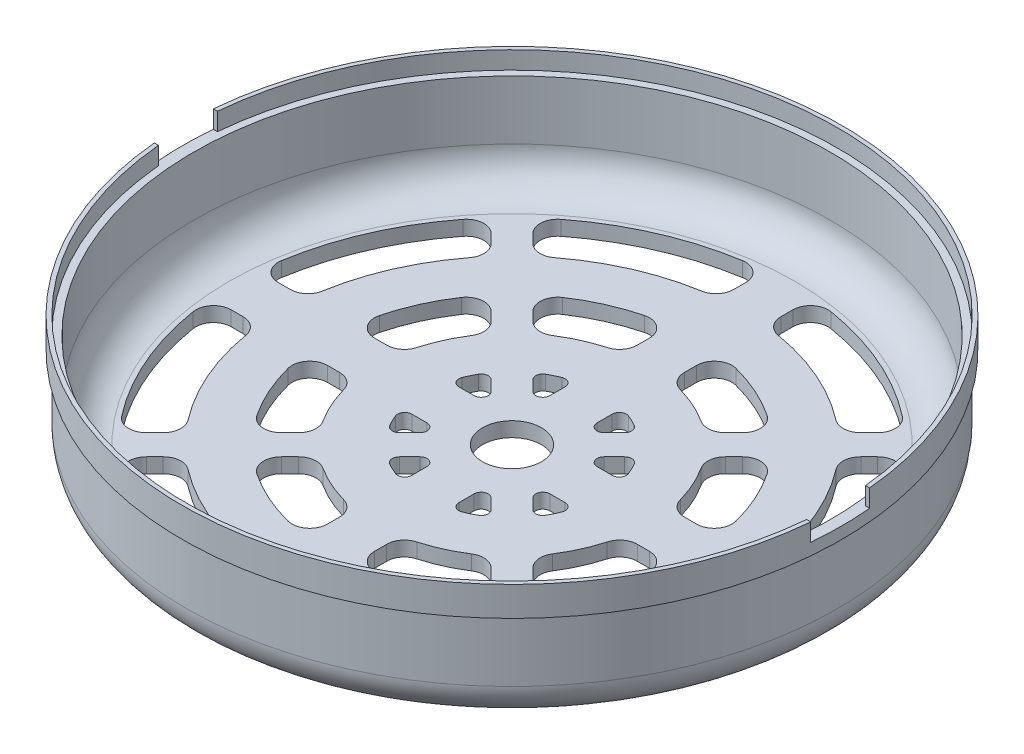
from build123d import *

# Parameters (mm, degrees)
SKETCH19_R          = 55.2
SKETCH19_R_2        = 5
BOSS_EXTRUDE1_DEPTH = 2.5
SKETCH20_R          = 55.2
SKETCH20_R_2        = 54
BOSS_EXTRUDE2_DEPTH = 16
FILLET1_R           = 6
SKETCH21_R          = 55.9
SKETCH21_R_2        = 55.2
BOSS_EXTRUDE3_DEPTH = 3
BOSS_EXTRUDE4_START = 2
SKETCH22_R          = 55.9
SKETCH22_R_2        = 54
BOSS_EXTRUDE4_DEPTH = 2
SKETCH23_W          = 205.777761972
SKETCH23_H          = 10
CUT_EXTRUDE1_DEPTH  = 4


with BuildPart() as part:
    # Sketch19 → Boss-Extrude1 (new body)
    with BuildSketch(Plane(origin=(0, 0, 0), x_dir=(1, 0, 0), z_dir=(0, 1, 0))):
        Circle(SKETCH19_R)
        Circle(SKETCH19_R_2, mode=Mode.SUBTRACT)
        with BuildLine():
            Line((11.315279718, 7.779745812), (9.584062043, 6.048528137))
            ThreePointArc((9.584062043, 6.048528137), (9.323934742, 4.740779881), (10.432590181, 4))
            Line((10.432590181, 4), (12.998461447, 4))
            ThreePointArc((12.998461447, 4), (13.992155853, 4.527265707), (14.112615286, 5.645714286))
            ThreePointArc((14.112615286, 5.645714286), (13.691809705, 6.601086805), (13.206419957, 7.525322047))
            ThreePointArc((13.206419957, 7.525322047), (12.323807885, 8.120503171), (11.315279718, 7.779745812))
        make_face(mode=Mode.SUBTRACT)
        with BuildLine():
            Line((7.779745812, 11.315279718), (6.048528137, 9.584062043))
            ThreePointArc((6.048528137, 9.584062043), (4.740779881, 9.323934742), (4, 10.432590181))
            Line((4, 10.432590181), (4, 12.998461447))
            ThreePointArc((4, 12.998461447), (4.527265707, 13.992155853), (5.645714286, 14.112615286))
            ThreePointArc((5.645714286, 14.112615286), (6.601086805, 13.691809705), (7.525322047, 13.206419957))
            ThreePointArc((7.525322047, 13.206419957), (8.120503171, 12.323807885), (7.779745812, 11.315279718))
        make_face(mode=Mode.SUBTRACT)
        with BuildLine():
            Line((-29.243440698, 32.778974604), (-27.817617952, 31.353151858))
            ThreePointArc((-27.817617952, 31.353151858), (-25.892213455, 30.480876207), (-23.869546594, 31.094770387))
            ThreePointArc((-23.869546594, 31.094770387), (-15.64959857, 35.940646413), (-6.502369668, 38.656942309))
            ThreePointArc((-6.502369668, 38.656942309), (-4.70948794, 39.677972547), (-4, 41.615381772))
            Line((-4, 41.615381772), (-4, 43.64218143))
            ThreePointArc((-4, 43.64218143), (-5.053893549, 45.925308602), (-7.475113122, 46.604320441))
            ThreePointArc((-7.475113122, 46.604320441), (-18.807456623, 43.291102728), (-28.962988252, 37.269093248))
            ThreePointArc((-28.962988252, 37.269093248), (-30.116285559, 35.087310264), (-29.243440698, 32.778974604))
        make_face(mode=Mode.SUBTRACT)
        with BuildLine():
            Line((-32.778974604, 29.243440698), (-31.353151858, 27.817617952))
            ThreePointArc((-31.353151858, 27.817617952), (-30.480876207, 25.892213455), (-31.094770387, 23.869546594))
            ThreePointArc((-31.094770387, 23.869546594), (-35.940646413, 15.64959857), (-38.656942309, 6.502369668))
            ThreePointArc((-38.656942309, 6.502369668), (-39.677972547, 4.70948794), (-41.615381772, 4))
            Line((-41.615381772, 4), (-43.64218143, 4))
            ThreePointArc((-43.64218143, 4), (-45.925308602, 5.053893549), (-46.604320441, 7.475113122))
            ThreePointArc((-46.604320441, 7.475113122), (-43.291102728, 18.807456623), (-37.269093248, 28.962988252))
            ThreePointArc((-37.269093248, 28.962988252), (-35.087310264, 30.116285559), (-32.778974604, 29.243440698))
        make_face(mode=Mode.SUBTRACT)
        with BuildLine():
            Line((-21.325246341, 17.789712435), (-19.881159788, 16.345625882))
            ThreePointArc((-19.881159788, 16.345625882), (-19.019238605, 14.540959916), (-19.483112178, 12.595568263))
            ThreePointArc((-19.483112178, 12.595568263), (-21.162980028, 9.506223033), (-22.356630537, 6.198473282))
            ThreePointArc((-22.356630537, 6.198473282), (-23.431614361, 4.612053167), (-25.247574141, 4))
            Line((-25.247574141, 4), (-27.317393726, 4))
            ThreePointArc((-27.317393726, 4), (-29.687419312, 5.160712441), (-30.223499442, 7.744680851))
            ThreePointArc((-30.223499442, 7.744680851), (-28.48866724, 12.72147157), (-25.940882289, 17.335242314))
            ThreePointArc((-25.940882289, 17.335242314), (-23.740534606, 18.653954494), (-21.325246341, 17.789712435))
        make_face(mode=Mode.SUBTRACT)
        with BuildLine():
            Line((-17.789712435, 21.325246341), (-16.345625882, 19.881159788))
            ThreePointArc((-16.345625882, 19.881159788), (-14.540959916, 19.019238605), (-12.595568263, 19.483112178))
            ThreePointArc((-12.595568263, 19.483112178), (-9.506223033, 21.162980028), (-6.198473282, 22.356630537))
            ThreePointArc((-6.198473282, 22.356630537), (-4.612053167, 23.431614361), (-4, 25.247574141))
            Line((-4, 25.247574141), (-4, 27.317393726))
            ThreePointArc((-4, 27.317393726), (-5.160712441, 29.687419312), (-7.744680851, 30.223499442))
            ThreePointArc((-7.744680851, 30.223499442), (-12.72147157, 28.48866724), (-17.335242314, 25.940882289))
            ThreePointArc((-17.335242314, 25.940882289), (-18.653954494, 23.740534606), (-17.789712435, 21.325246341))
        make_face(mode=Mode.SUBTRACT)
        with BuildLine():
            Line((-7.779745812, 11.315279718), (-6.048528137, 9.584062043))
            ThreePointArc((-6.048528137, 9.584062043), (-4.740779881, 9.323934742), (-4, 10.432590181))
            Line((-4, 10.432590181), (-4, 12.998461447))
            ThreePointArc((-4, 12.998461447), (-4.527265707, 13.992155853), (-5.645714286, 14.112615286))
            ThreePointArc((-5.645714286, 14.112615286), (-6.601086805, 13.691809705), (-7.525322047, 13.206419957))
            ThreePointArc((-7.525322047, 13.206419957), (-8.120503171, 12.323807885), (-7.779745812, 11.315279718))
        make_face(mode=Mode.SUBTRACT)
        with BuildLine():
            Line((-11.315279718, 7.779745812), (-9.584062043, 6.048528137))
            ThreePointArc((-9.584062043, 6.048528137), (-9.323934742, 4.740779881), (-10.432590181, 4))
            Line((-10.432590181, 4), (-12.998461447, 4))
            ThreePointArc((-12.998461447, 4), (-13.992155853, 4.527265707), (-14.112615286, 5.645714286))
            ThreePointArc((-14.112615286, 5.645714286), (-13.691809705, 6.601086805), (-13.206419957, 7.525322047))
            ThreePointArc((-13.206419957, 7.525322047), (-12.323807885, 8.120503171), (-11.315279718, 7.779745812))
        make_face(mode=Mode.SUBTRACT)
        with BuildLine():
            Line((4, 27.317393726), (4, 25.247574141))
            ThreePointArc((4, 25.247574141), (4.612053167, 23.431614361), (6.198473282, 22.356630537))
            ThreePointArc((6.198473282, 22.356630537), (9.506223033, 21.162980028), (12.595568263, 19.483112178))
            ThreePointArc((12.595568263, 19.483112178), (14.540959916, 19.019238605), (16.345625882, 19.881159788))
            Line((16.345625882, 19.881159788), (17.789712435, 21.325246341))
            ThreePointArc((17.789712435, 21.325246341), (18.653954494, 23.740534606), (17.335242314, 25.940882289))
            ThreePointArc((17.335242314, 25.940882289), (12.72147157, 28.48866724), (7.744680851, 30.223499442))
            ThreePointArc((7.744680851, 30.223499442), (5.160712441, 29.687419312), (4, 27.317393726))
        make_face(mode=Mode.SUBTRACT)
        with BuildLine():
            Line((21.325246341, 17.789712435), (19.881159788, 16.345625882))
            ThreePointArc((19.881159788, 16.345625882), (19.019238605, 14.540959916), (19.483112178, 12.595568263))
            ThreePointArc((19.483112178, 12.595568263), (21.162980028, 9.506223033), (22.356630537, 6.198473282))
            ThreePointArc((22.356630537, 6.198473282), (23.431614361, 4.612053167), (25.247574141, 4))
            Line((25.247574141, 4), (27.317393726, 4))
            ThreePointArc((27.317393726, 4), (29.687419312, 5.160712441), (30.223499442, 7.744680851))
            ThreePointArc((30.223499442, 7.744680851), (28.48866724, 12.72147157), (25.940882289, 17.335242314))
            ThreePointArc((25.940882289, 17.335242314), (23.740534606, 18.653954494), (21.325246341, 17.789712435))
        make_face(mode=Mode.SUBTRACT)
        with BuildLine():
            Line((32.778974604, 29.243440698), (31.353151858, 27.817617952))
            ThreePointArc((31.353151858, 27.817617952), (30.480876207, 25.892213455), (31.094770387, 23.869546594))
            ThreePointArc((31.094770387, 23.869546594), (35.940646413, 15.64959857), (38.656942309, 6.502369668))
            ThreePointArc((38.656942309, 6.502369668), (39.677972547, 4.70948794), (41.615381772, 4))
            Line((41.615381772, 4), (43.64218143, 4))
            ThreePointArc((43.64218143, 4), (45.925308602, 5.053893549), (46.604320441, 7.475113122))
            ThreePointArc((46.604320441, 7.475113122), (43.291102728, 18.807456623), (37.269093248, 28.962988252))
            ThreePointArc((37.269093248, 28.962988252), (35.087310264, 30.116285559), (32.778974604, 29.243440698))
        make_face(mode=Mode.SUBTRACT)
        with BuildLine():
            Line((4, 43.64218143), (4, 41.615381772))
            ThreePointArc((4, 41.615381772), (4.70948794, 39.677972547), (6.502369668, 38.656942309))
            ThreePointArc((6.502369668, 38.656942309), (15.64959857, 35.940646413), (23.869546594, 31.094770387))
            ThreePointArc((23.869546594, 31.094770387), (25.892213455, 30.480876207), (27.817617952, 31.353151858))
            Line((27.817617952, 31.353151858), (29.243440698, 32.778974604))
            ThreePointArc((29.243440698, 32.778974604), (30.116285559, 35.087310264), (28.962988252, 37.269093248))
            ThreePointArc((28.962988252, 37.269093248), (18.807456623, 43.291102728), (7.475113122, 46.604320441))
            ThreePointArc((7.475113122, 46.604320441), (5.053893549, 45.925308602), (4, 43.64218143))
        make_face(mode=Mode.SUBTRACT)
        with BuildLine():
            Line((4, -43.64218143), (4, -41.615381772))
            ThreePointArc((4, -41.615381772), (4.70948794, -39.677972547), (6.502369668, -38.656942309))
            ThreePointArc((6.502369668, -38.656942309), (15.64959857, -35.940646413), (23.869546594, -31.094770387))
            ThreePointArc((23.869546594, -31.094770387), (25.892213455, -30.480876207), (27.817617952, -31.353151858))
            Line((27.817617952, -31.353151858), (29.243440698, -32.778974604))
            ThreePointArc((29.243440698, -32.778974604), (30.116285559, -35.087310264), (28.962988252, -37.269093248))
            ThreePointArc((28.962988252, -37.269093248), (18.807456623, -43.291102728), (7.475113122, -46.604320441))
            ThreePointArc((7.475113122, -46.604320441), (5.053893549, -45.925308602), (4, -43.64218143))
        make_face(mode=Mode.SUBTRACT)
        with BuildLine():
            Line((32.778974604, -29.243440698), (31.353151858, -27.817617952))
            ThreePointArc((31.353151858, -27.817617952), (30.480876207, -25.892213455), (31.094770387, -23.869546594))
            ThreePointArc((31.094770387, -23.869546594), (35.940646413, -15.64959857), (38.656942309, -6.502369668))
            ThreePointArc((38.656942309, -6.502369668), (39.677972547, -4.70948794), (41.615381772, -4))
            Line((41.615381772, -4), (43.64218143, -4))
            ThreePointArc((43.64218143, -4), (45.925308602, -5.053893549), (46.604320441, -7.475113122))
            ThreePointArc((46.604320441, -7.475113122), (43.291102728, -18.807456623), (37.269093248, -28.962988252))
            ThreePointArc((37.269093248, -28.962988252), (35.087310264, -30.116285559), (32.778974604, -29.243440698))
        make_face(mode=Mode.SUBTRACT)
        with BuildLine():
            Line((27.317393726, -4), (25.247574141, -4))
            ThreePointArc((25.247574141, -4), (23.431614361, -4.612053167), (22.356630537, -6.198473282))
            ThreePointArc((22.356630537, -6.198473282), (21.162980028, -9.506223033), (19.483112178, -12.595568263))
            ThreePointArc((19.483112178, -12.595568263), (19.019238605, -14.540959916), (19.881159788, -16.345625882))
            Line((19.881159788, -16.345625882), (21.325246341, -17.789712435))
            ThreePointArc((21.325246341, -17.789712435), (23.740534606, -18.653954494), (25.940882289, -17.335242314))
            ThreePointArc((25.940882289, -17.335242314), (28.48866724, -12.72147157), (30.223499442, -7.744680851))
            ThreePointArc((30.223499442, -7.744680851), (29.687419312, -5.160712441), (27.317393726, -4))
        make_face(mode=Mode.SUBTRACT)
        with BuildLine():
            Line((12.998461447, -4), (10.432590181, -4))
            ThreePointArc((10.432590181, -4), (9.323934742, -4.740779881), (9.584062043, -6.048528137))
            Line((9.584062043, -6.048528137), (11.315279718, -7.779745812))
            ThreePointArc((11.315279718, -7.779745812), (12.323807885, -8.120503171), (13.206419957, -7.525322047))
            ThreePointArc((13.206419957, -7.525322047), (13.691809705, -6.601086805), (14.112615286, -5.645714286))
            ThreePointArc((14.112615286, -5.645714286), (13.992155853, -4.527265707), (12.998461447, -4))
        make_face(mode=Mode.SUBTRACT)
        with BuildLine():
            Line((4, -12.998461447), (4, -10.432590181))
            ThreePointArc((4, -10.432590181), (4.740779881, -9.323934742), (6.048528137, -9.584062043))
            Line((6.048528137, -9.584062043), (7.779745812, -11.315279718))
            ThreePointArc((7.779745812, -11.315279718), (8.120503171, -12.323807885), (7.525322047, -13.206419957))
            ThreePointArc((7.525322047, -13.206419957), (6.601086805, -13.691809705), (5.645714286, -14.112615286))
            ThreePointArc((5.645714286, -14.112615286), (4.527265707, -13.992155853), (4, -12.998461447))
        make_face(mode=Mode.SUBTRACT)
        with BuildLine():
            Line((4, -27.317393726), (4, -25.247574141))
            ThreePointArc((4, -25.247574141), (4.612053167, -23.431614361), (6.198473282, -22.356630537))
            ThreePointArc((6.198473282, -22.356630537), (9.506223033, -21.162980028), (12.595568263, -19.483112178))
            ThreePointArc((12.595568263, -19.483112178), (14.540959916, -19.019238605), (16.345625882, -19.881159788))
            Line((16.345625882, -19.881159788), (17.789712435, -21.325246341))
            ThreePointArc((17.789712435, -21.325246341), (18.653954494, -23.740534606), (17.335242314, -25.940882289))
            ThreePointArc((17.335242314, -25.940882289), (12.72147157, -28.48866724), (7.744680851, -30.223499442))
            ThreePointArc((7.744680851, -30.223499442), (5.160712441, -29.687419312), (4, -27.317393726))
        make_face(mode=Mode.SUBTRACT)
        with BuildLine():
            Line((-11.315279718, -7.779745812), (-9.584062043, -6.048528137))
            ThreePointArc((-9.584062043, -6.048528137), (-9.323934742, -4.740779881), (-10.432590181, -4))
            Line((-10.432590181, -4), (-12.998461447, -4))
            ThreePointArc((-12.998461447, -4), (-13.992155853, -4.527265707), (-14.112615286, -5.645714286))
            ThreePointArc((-14.112615286, -5.645714286), (-13.691809705, -6.601086805), (-13.206419957, -7.525322047))
            ThreePointArc((-13.206419957, -7.525322047), (-12.323807885, -8.120503171), (-11.315279718, -7.779745812))
        make_face(mode=Mode.SUBTRACT)
        with BuildLine():
            Line((-7.779745812, -11.315279718), (-6.048528137, -9.584062043))
            ThreePointArc((-6.048528137, -9.584062043), (-4.740779881, -9.323934742), (-4, -10.432590181))
            Line((-4, -10.432590181), (-4, -12.998461447))
            ThreePointArc((-4, -12.998461447), (-4.527265707, -13.992155853), (-5.645714286, -14.112615286))
            ThreePointArc((-5.645714286, -14.112615286), (-6.601086805, -13.691809705), (-7.525322047, -13.206419957))
            ThreePointArc((-7.525322047, -13.206419957), (-8.120503171, -12.323807885), (-7.779745812, -11.315279718))
        make_face(mode=Mode.SUBTRACT)
        with BuildLine():
            Line((-4, -27.317393726), (-4, -25.247574141))
            ThreePointArc((-4, -25.247574141), (-4.612053167, -23.431614361), (-6.198473282, -22.356630537))
            ThreePointArc((-6.198473282, -22.356630537), (-9.506223033, -21.162980028), (-12.595568263, -19.483112178))
            ThreePointArc((-12.595568263, -19.483112178), (-14.540959916, -19.019238605), (-16.345625882, -19.881159788))
            Line((-16.345625882, -19.881159788), (-17.789712435, -21.325246341))
            ThreePointArc((-17.789712435, -21.325246341), (-18.653954494, -23.740534606), (-17.335242314, -25.940882289))
            ThreePointArc((-17.335242314, -25.940882289), (-12.72147157, -28.48866724), (-7.744680851, -30.223499442))
            ThreePointArc((-7.744680851, -30.223499442), (-5.160712441, -29.687419312), (-4, -27.317393726))
        make_face(mode=Mode.SUBTRACT)
        with BuildLine():
            Line((-21.325246341, -17.789712435), (-19.881159788, -16.345625882))
            ThreePointArc((-19.881159788, -16.345625882), (-19.019238605, -14.540959916), (-19.483112178, -12.595568263))
            ThreePointArc((-19.483112178, -12.595568263), (-21.162980028, -9.506223033), (-22.356630537, -6.198473282))
            ThreePointArc((-22.356630537, -6.198473282), (-23.431614361, -4.612053167), (-25.247574141, -4))
            Line((-25.247574141, -4), (-27.317393726, -4))
            ThreePointArc((-27.317393726, -4), (-29.687419312, -5.160712441), (-30.223499442, -7.744680851))
            ThreePointArc((-30.223499442, -7.744680851), (-28.48866724, -12.72147157), (-25.940882289, -17.335242314))
            ThreePointArc((-25.940882289, -17.335242314), (-23.740534606, -18.653954494), (-21.325246341, -17.789712435))
        make_face(mode=Mode.SUBTRACT)
        with BuildLine():
            Line((-32.778974604, -29.243440698), (-31.353151858, -27.817617952))
            ThreePointArc((-31.353151858, -27.817617952), (-30.480876207, -25.892213455), (-31.094770387, -23.869546594))
            ThreePointArc((-31.094770387, -23.869546594), (-35.940646413, -15.64959857), (-38.656942309, -6.502369668))
            ThreePointArc((-38.656942309, -6.502369668), (-39.677972547, -4.70948794), (-41.615381772, -4))
            Line((-41.615381772, -4), (-43.64218143, -4))
            ThreePointArc((-43.64218143, -4), (-45.925308602, -5.053893549), (-46.604320441, -7.475113122))
            ThreePointArc((-46.604320441, -7.475113122), (-43.291102728, -18.807456623), (-37.269093248, -28.962988252))
            ThreePointArc((-37.269093248, -28.962988252), (-35.087310264, -30.116285559), (-32.778974604, -29.243440698))
        make_face(mode=Mode.SUBTRACT)
        with BuildLine():
            Line((-4, -43.64218143), (-4, -41.615381772))
            ThreePointArc((-4, -41.615381772), (-4.70948794, -39.677972547), (-6.502369668, -38.656942309))
            ThreePointArc((-6.502369668, -38.656942309), (-15.64959857, -35.940646413), (-23.869546594, -31.094770387))
            ThreePointArc((-23.869546594, -31.094770387), (-25.892213455, -30.480876207), (-27.817617952, -31.353151858))
            Line((-27.817617952, -31.353151858), (-29.243440698, -32.778974604))
            ThreePointArc((-29.243440698, -32.778974604), (-30.116285559, -35.087310264), (-28.962988252, -37.269093248))
            ThreePointArc((-28.962988252, -37.269093248), (-18.807456623, -43.291102728), (-7.475113122, -46.604320441))
            ThreePointArc((-7.475113122, -46.604320441), (-5.053893549, -45.925308602), (-4, -43.64218143))
        make_face(mode=Mode.SUBTRACT)
    extrude(amount=BOSS_EXTRUDE1_DEPTH)

    # Sketch20 → Boss-Extrude2 (add)
    with BuildSketch(Plane(origin=(0, 2.5, 0), x_dir=(1, 0, 0), z_dir=(0, 1, 0))):
        Circle(SKETCH20_R)
        Circle(SKETCH20_R_2, mode=Mode.SUBTRACT)
    extrude(amount=BOSS_EXTRUDE2_DEPTH)

    # Fillet1
    fillet1_edges = [part.edges().sort_by_distance(p)[0] for p in [
        (-54, 2.5, 0),
        (-55.2, 0, 0),
    ]]
    fillet(fillet1_edges, radius=FILLET1_R)



with BuildPart() as body_2:
    # Sketch21 → Boss-Extrude3 (new body)
    with BuildSketch(Plane(origin=(0, 18.5, 0), x_dir=(1, 0, 0), z_dir=(0, 1, 0))):
        Circle(SKETCH21_R)
        Circle(SKETCH21_R_2, mode=Mode.SUBTRACT)
    extrude(amount=BOSS_EXTRUDE3_DEPTH)


with BuildPart() as part_1:
    add(part.part)

    add(body_2.part)  # Boss-Extrude4 merges body 2
    # Sketch22 → Boss-Extrude4 (add)
    with BuildSketch(Plane.XZ.offset(-18.5).offset(BOSS_EXTRUDE4_START)):
        Circle(SKETCH22_R)
        Circle(SKETCH22_R_2, mode=Mode.SUBTRACT)
    extrude(amount=-BOSS_EXTRUDE4_DEPTH)

    # Sketch23 → Cut-Extrude1 (cut)
    with BuildSketch(Plane(origin=(0, 18.5, 0), x_dir=(1, 0, 0), z_dir=(0, 1, 0))):
        Rectangle(SKETCH23_W, SKETCH23_H)
    extrude(amount=CUT_EXTRUDE1_DEPTH, mode=Mode.SUBTRACT)


solid = part_1.part
